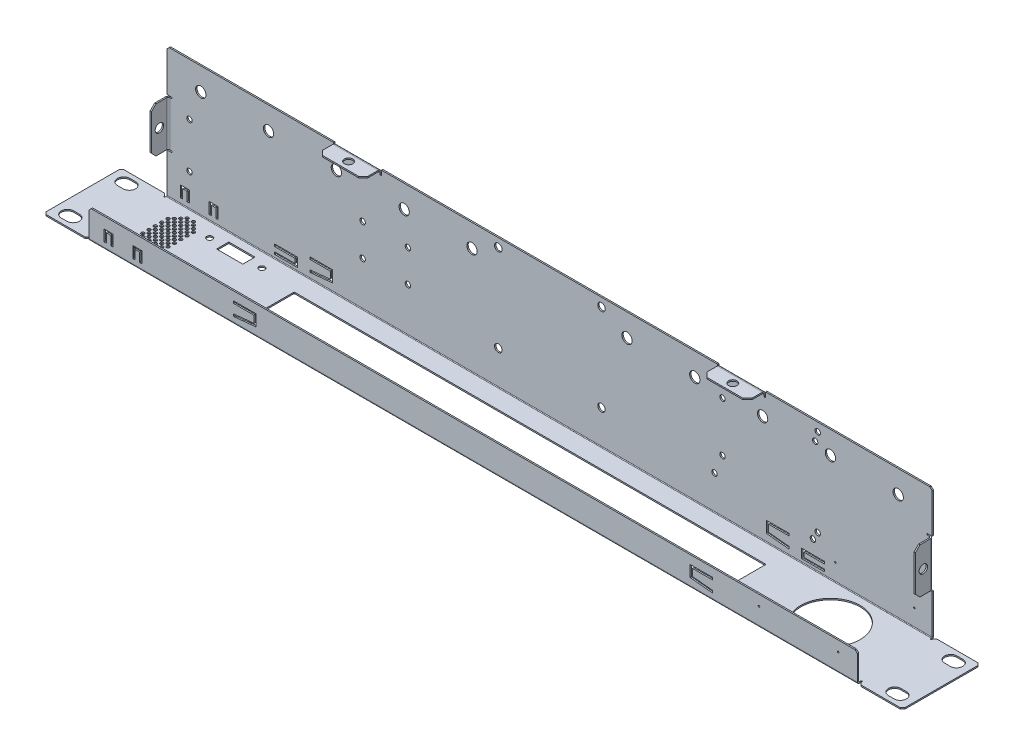
from build123d import *

# Parameters (mm, degrees)
SKETCH2_W                     = 482.6
SKETCH2_H                     = 43.6626
BASE_FLANGE1_DEPTH            = 0.762
EDGE_FLANGE1_STRIP_W          = 3.81
EDGE_FLANGE1_STRIP_H          = 0.762
EDGE_FLANGE1_STRIP_CUT_DEPTH  = 430.022
EDGE_FLANGE1_RELIEF_W         = 4.572
EDGE_FLANGE1_RELIEF_H         = 0.762
EDGE_FLANGE1_RELIEF_CUT_DEPTH = 0.762
EDGE_FLANGE1_DEPTH            = 430.022
EDGE_FLANGE2_START            = -2
EDGE_FLANGE2_DEPTH            = 2.381
EDGE_FLANGE2_START_2          = 0.381
EDGE_FLANGE2_2_OUTLINE_W      = 431.8
EDGE_FLANGE2_2_OUTLINE_H      = 0.762
EDGE_FLANGE2_2_DEPTH          = 15.113
EDGE_FLANGE2_START_3          = -215.9
EDGE_FLANGE2_3_DEPTH          = 431.8
EDGE_FLANGE2_4_DEPTH          = 431.8
CUT_EXTRUDE1_DEPTH            = 2.54
CUT_EXTRUDE2_DEPTH            = 2.54
SKETCH16_R                    = 1.6256
SKETCH16_R_2                  = 16.6624
SKETCH16_W                    = 14.732
SKETCH16_H                    = 6.858
CUT_EXTRUDE3_DEPTH            = 15.875
SKETCH22_R                    = 0.889
CUT_EXTRUDE6_DEPTH            = 10.414
SKETCH31_R                    = 0.4445
CUT_EXTRUDE7_DEPTH            = 53.848
CUT_EXTRUDE10_DEPTH           = 2.54
CUT_EXTRUDE11_DEPTH           = 256.695658712
CUT_EXTRUDE11_DEPTH_BACK      = 256.695658712
SKETCH33_R                    = 2.1082
CUT_EXTRUDE12_DEPTH           = 256.824609924
CHAMFER1_SIZE                 = 1.27
CUT_EXTRUDE13_DEPTH           = 256.695658712
CUT_EXTRUDE13_DEPTH_BACK      = 256.695658712
SKETCH39_R                    = 2.8956
CUT_EXTRUDE14_DEPTH           = 2.54
SKETCH41_R                    = 1.524
CUT_EXTRUDE15_DEPTH           = 2.54
SKETCH42_R                    = 1.524
CUT_EXTRUDE16_DEPTH           = 2.54
SKETCH45_R                    = 1.524
CUT_EXTRUDE17_DEPTH           = 2.54
SKETCH46_R                    = 1.524
CUT_EXTRUDE18_DEPTH           = 2.54
EDGE_FLANGE3_START            = -23
EDGE_FLANGE3_DEPTH            = 2.9213
EDGE_FLANGE3_2_OUTLINE_W      = 0.762
EDGE_FLANGE3_2_OUTLINE_H      = 25.4
EDGE_FLANGE3_2_DEPTH          = 1.24698788
EDGE_FLANGE3_START_2          = -20.0787
EDGE_FLANGE3_3_OUTLINE_W      = 0.762
EDGE_FLANGE3_3_OUTLINE_H      = 25.4
EDGE_FLANGE3_3_DEPTH          = 8.4074
EDGE_FLANGE3_START_3          = 23.3045
EDGE_FLANGE3_4_DEPTH          = 25.4
EDGE_FLANGE3_5_DEPTH          = 25.4
EDGE_FLANGE4_START            = -20.0787
EDGE_FLANGE4_OUTLINE_W        = 25.4
EDGE_FLANGE4_OUTLINE_H        = 0.762
EDGE_FLANGE4_DEPTH            = 8.4074
EDGE_FLANGE4_START_2          = -23
EDGE_FLANGE4_2_DEPTH          = 2.9213
EDGE_FLANGE4_START_3          = 95.25
EDGE_FLANGE4_3_DEPTH          = 25.4
EDGE_FLANGE4_4_DEPTH          = 25.4
EDGE_FLANGE5_START            = -121.412
EDGE_FLANGE5_DEPTH            = 26.924
EDGE_FLANGE5_START_2          = -120.65
EDGE_FLANGE5_2_DEPTH          = 25.4
EDGE_FLANGE5_START_3          = -23
EDGE_FLANGE5_3_DEPTH          = 2.9213
SKETCH60_R                    = 2.3749
CUT_EXTRUDE19_DEPTH           = 2.54
SKETCH61_R                    = 2.3749
CUT_EXTRUDE20_DEPTH           = 463.612637943
CHAMFER2_SIZE                 = 2.54


with BuildPart() as part:
    # Base-Flange1: sheet metal written as solids
    # Sketch2 → Base-Flange1 (new body)
    with BuildSketch(Plane(origin=(0, 0, 0), x_dir=(1, 0, 0), z_dir=(0, 1, 0))):
        Rectangle(SKETCH2_W, SKETCH2_H)
    extrude(amount=-BASE_FLANGE1_DEPTH)

    # Edge-Flange1: sheet metal written as solids
    # Edge-Flange1 strip (on a plane across the edge) → Edge-Flange1 strip cut (cut)
    with BuildSketch(Plane(origin=(215.011, 0, -21.8313), x_dir=(0, 0, 1), z_dir=(-1, 0, 0))):
        with Locations((-0.762, -0.381)):
            Rectangle(EDGE_FLANGE1_STRIP_W, EDGE_FLANGE1_STRIP_H)
    extrude(amount=EDGE_FLANGE1_STRIP_CUT_DEPTH, mode=Mode.SUBTRACT)

    # Edge-Flange1 relief (on the sheet) → Edge-Flange1 relief cut (cut)
    with BuildSketch(Plane(origin=(215.011, 0, -20.6883), x_dir=(0, 0, 1), z_dir=(0, 1, 0))):
        with Locations((-1.524, 0.381)):
            Rectangle(EDGE_FLANGE1_RELIEF_W, EDGE_FLANGE1_RELIEF_H)
        with Locations((-1.524, -430.403)):
            Rectangle(EDGE_FLANGE1_RELIEF_W, EDGE_FLANGE1_RELIEF_H)
    extrude(amount=-EDGE_FLANGE1_RELIEF_CUT_DEPTH, mode=Mode.SUBTRACT)

    # Edge-Flange1 section (on a plane across the edge) → Edge-Flange1 (add)
    with BuildSketch(Plane(origin=(215.011, 0, -21.8313), x_dir=(0, 0, 1), z_dir=(-1, 0, 0))):
        with BuildLine():
            Line((0, 0.381), (0, 72.898))
            Line((0, 72.898), (0.762, 72.898))
            Line((0.762, 72.898), (0.762, 0.381))
            ThreePointArc((0.762, 0.381), (0.873592316, 0.111592316), (1.143, 0))
            Line((1.143, 0), (1.143, -0.762))
            ThreePointArc((1.143, -0.762), (0.334776949, -0.427223051), (0, 0.381))
        make_face()
    extrude(amount=EDGE_FLANGE1_DEPTH)

    # Edge-Flange2: read off the stored shape, not the designer's step
    # Edge-Flange2 outline → Edge-Flange2 (cut)
    with BuildSketch(Plane(origin=(0, 0, 0), x_dir=(1, 0, 0), z_dir=(0, 1, 0)).offset(EDGE_FLANGE2_START)):
        with BuildLine():
            Line((215.9, -19.9263), (215.9, -21.8313))
            Line((215.9, -21.8313), (216.662, -21.8313))
            Line((216.662, -21.8313), (216.662, -19.9263))
            ThreePointArc((216.662, -19.9263), (216.281, -19.5453), (215.9, -19.9263))
        make_face()
        with BuildLine():
            Line((-216.662, -21.8313), (-215.9, -21.8313))
            Line((-215.9, -21.8313), (-215.9, -19.9263))
            ThreePointArc((-215.9, -19.9263), (-216.281, -19.5453), (-216.662, -19.9263))
            Line((-216.662, -19.9263), (-216.662, -21.8313))
        make_face()
    extrude(amount=EDGE_FLANGE2_DEPTH, mode=Mode.SUBTRACT)

    # Edge-Flange2 3 outline → Edge-Flange2 3 (cut)
    with BuildSketch(Plane.YZ.offset(EDGE_FLANGE2_START_3)):
        with BuildLine():
            ThreePointArc((-0.762, 20.6883), (-0.552255592, 21.348211358), (0, 21.765930735))
            Line((0, 21.765930735), (0, 21.8313))
            Line((0, 21.8313), (-0.762, 21.8313))
            Line((-0.762, 21.8313), (-0.762, 20.6883))
        make_face()
    extrude(amount=EDGE_FLANGE2_3_DEPTH, mode=Mode.SUBTRACT)



with BuildPart() as body_2:
    # Edge-Flange2 2 outline → Edge-Flange2 2 (new body)
    with BuildSketch(Plane(origin=(0, 0, 0), x_dir=(1, 0, 0), z_dir=(0, 1, 0)).offset(EDGE_FLANGE2_START_2)):
        with Locations((0, -21.4503)):
            Rectangle(EDGE_FLANGE2_2_OUTLINE_W, EDGE_FLANGE2_2_OUTLINE_H)
    extrude(amount=EDGE_FLANGE2_2_DEPTH)


with BuildPart() as part_1:
    add(part.part)

    add(body_2.part)  # Edge-Flange2 4 merges body 2
    # Edge-Flange2 4 outline → Edge-Flange2 4 (add)
    with BuildSketch(Plane.YZ.offset(EDGE_FLANGE2_START_3)):
        with BuildLine():
            Line((0.381, 21.0693), (0.381, 21.8313))
            ThreePointArc((0.381, 21.8313), (0.187716438, 21.814839154), (0, 21.765930735))
            Line((0, 21.765930735), (0, 20.6883))
            ThreePointArc((0, 20.6883), (0.111592316, 20.957707684), (0.381, 21.0693))
        make_face()
    extrude(amount=EDGE_FLANGE2_4_DEPTH)

    # Sketch14 → Cut-Extrude1 (cut)
    with BuildSketch(Plane.XZ.offset(0.762)):
        with BuildLine():
            Line((230.8225, -19.2913), (233.9975, -19.2913))
            ThreePointArc((233.9975, -19.2913), (237.49, -15.7988), (233.9975, -12.3063))
            Line((233.9975, -12.3063), (230.8225, -12.3063))
            ThreePointArc((230.8225, -12.3063), (227.33, -15.7988), (230.8225, -19.2913))
        make_face()
        with BuildLine():
            Line((230.8225, 12.3063), (233.9975, 12.3063))
            ThreePointArc((233.9975, 12.3063), (237.49, 15.7988), (233.9975, 19.2913))
            Line((233.9975, 19.2913), (230.8225, 19.2913))
            ThreePointArc((230.8225, 19.2913), (227.33, 15.7988), (230.8225, 12.3063))
        make_face()
        with BuildLine():
            Line((-230.8225, 19.2913), (-233.9975, 19.2913))
            ThreePointArc((-233.9975, 19.2913), (-237.49, 15.7988), (-233.9975, 12.3063))
            Line((-233.9975, 12.3063), (-230.8225, 12.3063))
            ThreePointArc((-230.8225, 12.3063), (-227.33, 15.7988), (-230.8225, 19.2913))
        make_face()
        with BuildLine():
            Line((-230.8225, -12.3063), (-233.9975, -12.3063))
            ThreePointArc((-233.9975, -12.3063), (-237.49, -15.7988), (-233.9975, -19.2913))
            Line((-233.9975, -19.2913), (-230.8225, -19.2913))
            ThreePointArc((-230.8225, -19.2913), (-227.33, -15.7988), (-230.8225, -12.3063))
        make_face()
    extrude(amount=-CUT_EXTRUDE1_DEPTH, mode=Mode.SUBTRACT)

    # Sketch15 → Cut-Extrude2 (cut)
    with BuildSketch(Plane.XZ.offset(0.762)):
        with BuildLine():
            Line((-132.11175, 16.764), (132.11175, 16.764))
            ThreePointArc((132.11175, 16.764), (132.426058964, 16.633808964), (132.55625, 16.3195))
            Line((132.55625, 16.3195), (132.55625, -9.7155))
            ThreePointArc((132.55625, -9.7155), (132.426058964, -10.029808964), (132.11175, -10.16))
            Line((132.11175, -10.16), (-132.11175, -10.16))
            ThreePointArc((-132.11175, -10.16), (-132.426058964, -10.029808964), (-132.55625, -9.7155))
            Line((-132.55625, -9.7155), (-132.55625, 16.3195))
            ThreePointArc((-132.55625, 16.3195), (-132.426058964, 16.633808964), (-132.11175, 16.764))
        make_face()
    extrude(amount=-CUT_EXTRUDE2_DEPTH, mode=Mode.SUBTRACT)

    # Sketch16 → Cut-Extrude3 (cut)
    with BuildSketch(Plane.XZ.offset(0.762)):
        with Locations(Location((-182.578968496, -12.7, 0), (0, 0, 270))):
            Circle(SKETCH16_R)
        with Locations(Location((-153.235989929, -12.7, 0), (0, 0, 270))):
            Circle(SKETCH16_R)
        with Locations(Location((178.959736329, 0, 0), (0, 0, 270))):
            Circle(SKETCH16_R_2)
        with Locations((-167.907479213, -12.7)):
            Rectangle(SKETCH16_W, SKETCH16_H)
    extrude(amount=-CUT_EXTRUDE3_DEPTH, mode=Mode.SUBTRACT)

    # Sketch22 → Cut-Extrude6 (cut)
    with BuildSketch(Plane(origin=(0, 0, 0), x_dir=(1, 0, 0), z_dir=(0, 1, 0))):
        with Locations(Location((-195.108436701, -1.706248663, 0), (0, 0, 270))):
            Circle(SKETCH22_R)
        with Locations(Location((-196.814685364, 0, 0), (0, 0, 270))):
            Circle(SKETCH22_R)
        with Locations(Location((-193.402188038, -3.412497326, 0), (0, 0, 270))):
            Circle(SKETCH22_R)
        with Locations(Location((-189.989690712, -6.824994652, 0), (0, 0, 270))):
            Circle(SKETCH22_R)
        with Locations(Location((-189.989690712, -10.380994652, 0), (0, 0, 270))):
            Circle(SKETCH22_R)
        with Locations(Location((-191.695939375, -12.230745989, 0), (0, 0, 270))):
            Circle(SKETCH22_R)
        with Locations(Location((-193.402188038, -14.080497326, 0), (0, 0, 270))):
            Circle(SKETCH22_R)
        with Locations(Location((-195.108436701, -15.930248663, 0), (0, 0, 270))):
            Circle(SKETCH22_R)
        with Locations(Location((-198.520934027, -16.073751337, 0), (0, 0, 270))):
            Circle(SKETCH22_R)
        with Locations(Location((-200.22718269, -14.367502674, 0), (0, 0, 270))):
            Circle(SKETCH22_R)
        with Locations(Location((-203.639680016, -10.955005348, 0), (0, 0, 270))):
            Circle(SKETCH22_R)
        with Locations(Location((-203.639680016, -7.399005348, 0), (0, 0, 270))):
            Circle(SKETCH22_R)
        with Locations(Location((-203.639680016, -3.843005348, 0), (0, 0, 270))):
            Circle(SKETCH22_R)
        with Locations(Location((-203.639680016, -0.287005348, 0), (0, 0, 270))):
            Circle(SKETCH22_R)
        with Locations(Location((-203.639680016, 3.268994652, 0), (0, 0, 270))):
            Circle(SKETCH22_R)
        with Locations(Location((-203.639680016, 10.380994652, 0), (0, 0, 270))):
            Circle(SKETCH22_R)
        with Locations(Location((-201.933431353, 12.230745989, 0), (0, 0, 270))):
            Circle(SKETCH22_R)
        with Locations(Location((-200.22718269, 14.080497326, 0), (0, 0, 270))):
            Circle(SKETCH22_R)
        with Locations(Location((-198.520934027, 15.930248663, 0), (0, 0, 270))):
            Circle(SKETCH22_R)
        with Locations(Location((-195.108436701, 16.073751337, 0), (0, 0, 270))):
            Circle(SKETCH22_R)
        with Locations(Location((-193.402188038, 14.367502674, 0), (0, 0, 270))):
            Circle(SKETCH22_R)
        with Locations(Location((-191.695939375, 12.661254011, 0), (0, 0, 270))):
            Circle(SKETCH22_R)
        with Locations(Location((-189.989690712, 10.955005348, 0), (0, 0, 270))):
            Circle(SKETCH22_R)
        with Locations(Location((-189.989690712, 7.399005348, 0), (0, 0, 270))):
            Circle(SKETCH22_R)
        with Locations(Location((-189.989690712, 3.843005348, 0), (0, 0, 270))):
            Circle(SKETCH22_R)
        with Locations(Location((-189.989690712, 0.287005348, 0), (0, 0, 270))):
            Circle(SKETCH22_R)
        with Locations(Location((-189.989690712, -3.268994652, 0), (0, 0, 270))):
            Circle(SKETCH22_R)
        with Locations(Location((-191.695939375, -5.118745989, 0), (0, 0, 270))):
            Circle(SKETCH22_R)
        with Locations(Location((-196.814685364, -14.224, 0), (0, 0, 270))):
            Circle(SKETCH22_R)
        with Locations(Location((-198.520934027, -12.517751337, 0), (0, 0, 270))):
            Circle(SKETCH22_R)
        with Locations(Location((-195.108436701, -12.374248663, 0), (0, 0, 270))):
            Circle(SKETCH22_R)
        with Locations(Location((-196.814685364, -10.668, 0), (0, 0, 270))):
            Circle(SKETCH22_R)
        with Locations(Location((-200.22718269, -10.811502674, 0), (0, 0, 270))):
            Circle(SKETCH22_R)
        with Locations(Location((-193.402188038, -10.524497326, 0), (0, 0, 270))):
            Circle(SKETCH22_R)
        with Locations(Location((-201.933431353, -9.105254011, 0), (0, 0, 270))):
            Circle(SKETCH22_R)
        with Locations(Location((-198.520934027, -8.961751337, 0), (0, 0, 270))):
            Circle(SKETCH22_R)
        with Locations(Location((-195.108436701, -8.818248663, 0), (0, 0, 270))):
            Circle(SKETCH22_R)
        with Locations(Location((-191.695939375, -8.674745989, 0), (0, 0, 270))):
            Circle(SKETCH22_R)
        with Locations(Location((-200.22718269, -7.255502674, 0), (0, 0, 270))):
            Circle(SKETCH22_R)
        with Locations(Location((-196.814685364, -7.112, 0), (0, 0, 270))):
            Circle(SKETCH22_R)
        with Locations(Location((-193.402188038, -6.968497326, 0), (0, 0, 270))):
            Circle(SKETCH22_R)
        with Locations(Location((-201.933431353, -5.549254011, 0), (0, 0, 270))):
            Circle(SKETCH22_R)
        with Locations(Location((-198.520934027, -5.405751337, 0), (0, 0, 270))):
            Circle(SKETCH22_R)
        with Locations(Location((-195.108436701, -5.262248663, 0), (0, 0, 270))):
            Circle(SKETCH22_R)
        with Locations(Location((-200.22718269, -3.699502674, 0), (0, 0, 270))):
            Circle(SKETCH22_R)
        with Locations(Location((-196.814685364, -3.556, 0), (0, 0, 270))):
            Circle(SKETCH22_R)
        with Locations(Location((-191.695939375, -1.562745989, 0), (0, 0, 270))):
            Circle(SKETCH22_R)
        with Locations(Location((-198.520934027, -1.849751337, 0), (0, 0, 270))):
            Circle(SKETCH22_R)
        with Locations(Location((-201.933431353, -1.993254011, 0), (0, 0, 270))):
            Circle(SKETCH22_R)
        with Locations(Location((-200.22718269, -0.143502674, 0), (0, 0, 270))):
            Circle(SKETCH22_R)
        with Locations(Location((-201.933431353, 1.562745989, 0), (0, 0, 270))):
            Circle(SKETCH22_R)
        with Locations(Location((-195.108436701, 1.849751337, 0), (0, 0, 270))):
            Circle(SKETCH22_R)
        with Locations(Location((-193.402188038, 0.143502674, 0), (0, 0, 270))):
            Circle(SKETCH22_R)
        with Locations(Location((-191.695939375, 1.993254011, 0), (0, 0, 270))):
            Circle(SKETCH22_R)
        with Locations(Location((-198.520934027, 1.706248663, 0), (0, 0, 270))):
            Circle(SKETCH22_R)
        with Locations(Location((-200.22718269, 3.412497326, 0), (0, 0, 270))):
            Circle(SKETCH22_R)
        with Locations(Location((-196.814685364, 3.556, 0), (0, 0, 270))):
            Circle(SKETCH22_R)
        with Locations(Location((-193.402188038, 3.699502674, 0), (0, 0, 270))):
            Circle(SKETCH22_R)
        with Locations(Location((-191.695939375, 5.549254011, 0), (0, 0, 270))):
            Circle(SKETCH22_R)
        with Locations(Location((-195.108436701, 5.405751337, 0), (0, 0, 270))):
            Circle(SKETCH22_R)
        with Locations(Location((-198.520934027, 5.262248663, 0), (0, 0, 270))):
            Circle(SKETCH22_R)
        with Locations(Location((-200.22718269, 6.968497326, 0), (0, 0, 270))):
            Circle(SKETCH22_R)
        with Locations(Location((-201.933431353, 5.118745989, 0), (0, 0, 270))):
            Circle(SKETCH22_R)
        with Locations(Location((-196.814685364, 7.112, 0), (0, 0, 270))):
            Circle(SKETCH22_R)
        with Locations(Location((-193.402188038, 7.255502674, 0), (0, 0, 270))):
            Circle(SKETCH22_R)
        with Locations(Location((-195.108436701, 8.961751337, 0), (0, 0, 270))):
            Circle(SKETCH22_R)
        with Locations(Location((-191.695939375, 9.105254011, 0), (0, 0, 270))):
            Circle(SKETCH22_R)
        with Locations(Location((-198.520934027, 8.818248663, 0), (0, 0, 270))):
            Circle(SKETCH22_R)
        with Locations(Location((-201.933431353, 8.674745989, 0), (0, 0, 270))):
            Circle(SKETCH22_R)
        with Locations(Location((-196.814685364, 10.668, 0), (0, 0, 270))):
            Circle(SKETCH22_R)
        with Locations(Location((-193.402188038, 10.811502674, 0), (0, 0, 270))):
            Circle(SKETCH22_R)
        with Locations(Location((-196.814685364, 14.224, 0), (0, 0, 270))):
            Circle(SKETCH22_R)
        with Locations(Location((-195.108436701, 12.517751337, 0), (0, 0, 270))):
            Circle(SKETCH22_R)
        with Locations(Location((-198.520934027, 12.374248663, 0), (0, 0, 270))):
            Circle(SKETCH22_R)
        with Locations(Location((-200.22718269, 10.524497326, 0), (0, 0, 270))):
            Circle(SKETCH22_R)
        with Locations(Location((-203.639680016, 6.824994652, 0), (0, 0, 270))):
            Circle(SKETCH22_R)
        with Locations(Location((-201.933431353, -12.661254011, 0), (0, 0, 270))):
            Circle(SKETCH22_R)
    extrude(amount=-CUT_EXTRUDE6_DEPTH, mode=Mode.SUBTRACT)

    # Sketch31 → Cut-Extrude7 (cut)
    with BuildSketch(Plane.XY.offset(21.8313)):
        with Locations((205.060246339, 9.5885)):
            Circle(SKETCH31_R)
        with Locations((160.610246339, 9.5885)):
            Circle(SKETCH31_R)
    extrude(amount=-CUT_EXTRUDE7_DEPTH, mode=Mode.SUBTRACT)

    # Sketch34 → Cut-Extrude10 (cut)
    with BuildSketch(Plane.XY.offset(-21.0693)):
        Polygon((-154.4066, 6.985), (-154.4066, 5.715), (-142.9766, 5.715), (-142.9766, 3.175), (-154.4066, 3.175), (-154.4066, 1.905), (-141.7066, 1.905), (-141.7066, 6.985), align=None)
        Polygon((141.7066, 6.985), (141.7066, 1.905), (154.4066, 1.905), (154.4066, 3.175), (142.9766, 3.175), (142.9766, 5.715), (154.4066, 5.715), (154.4066, 6.985), align=None)
    extrude(amount=-CUT_EXTRUDE10_DEPTH, mode=Mode.SUBTRACT)

    # Sketch35 → Cut-Extrude11 (cut, two sides: drawn at the far end of the back side and taken through both)
    with BuildSketch(Plane(origin=(0, 0, 21.0693), x_dir=(-1, 0, 0), z_dir=(0, 0, -1)).offset(-CUT_EXTRUDE11_DEPTH_BACK)):
        Polygon((123.19, 5.424457691), (134.62, 4.32387387), (134.498275894, 3.059720698), (121.92, 4.270870912), (121.92, 10.668), (134.62, 10.668), (134.62, 9.398), (123.19, 9.398), align=None)
        Polygon((-134.498275894, 3.059720698), (-134.62, 4.32387387), (-123.19, 5.424457691), (-123.19, 9.398), (-134.62, 9.398), (-134.62, 10.668), (-121.92, 10.668), (-121.92, 4.270870912), align=None)
    extrude(amount=CUT_EXTRUDE11_DEPTH + CUT_EXTRUDE11_DEPTH_BACK, mode=Mode.SUBTRACT)

    # Sketch33 → Cut-Extrude12 (cut, through all)
    with BuildSketch(Plane(origin=(0, 0, -21.8313), x_dir=(-1, 0, 0), z_dir=(0, 0, -1))):
        with Locations(Location((-29.228077599, 68.125166205, 0), (0, 0, 90))):
            Circle(SKETCH33_R)
        with Locations(Location((28.771907581, 68.132146338, 0), (0, 0, 90))):
            Circle(SKETCH33_R)
        with Locations(Location((-29.222180588, 19.12516656, 0), (0, 0, 90))):
            Circle(SKETCH33_R)
        with Locations(Location((28.777804592, 19.132143093, 0), (0, 0, 90))):
            Circle(SKETCH33_R)
    extrude(amount=-CUT_EXTRUDE12_DEPTH, mode=Mode.SUBTRACT)

    # Chamfer1
    chamfer1_edges = [part_1.edges().sort_by_distance(p)[0] for p in [
        (215.773, -0.381, -21.8313),
        (-215.773, -0.381, -21.8313),
        (215.011, 72.898, -21.4503),
        (-215.011, 72.898, -21.4503),
        (-216.662, -0.381, 21.8313),
        (216.662, -0.381, 21.8313),
        (241.3, -0.381, 21.8313),
        (-241.3, -0.381, 21.8313),
        (-241.3, -0.381, -21.8313),
        (241.3, -0.381, -21.8313),
        (-215.9, 15.494, 21.4503),
        (215.9, 15.494, 21.4503),
    ]]
    chamfer(chamfer1_edges, length=CHAMFER1_SIZE)

    # Sketch37 → Cut-Extrude13 (cut, two sides: drawn at the far end of the back side and taken through both)
    with BuildSketch(Plane.XY.offset(-21.0693).offset(-CUT_EXTRUDE13_DEPTH_BACK)):
        Polygon((-187.45607289, 2.921), (-187.45607289, 8.001), (-189.99607289, 8.001), (-189.99607289, 2.921), (-191.26607289, 2.921), (-191.26607289, 9.271), (-186.18607289, 9.271), (-186.18607289, 2.921), align=None)
        Polygon((-202.363297886, 2.921), (-203.633297886, 2.921), (-203.633297886, 8.001), (-206.173297886, 8.001), (-206.173297886, 2.921), (-207.443297886, 2.921), (-207.443297886, 9.271), (-202.363297886, 9.271), align=None)
    extrude(amount=CUT_EXTRUDE13_DEPTH + CUT_EXTRUDE13_DEPTH_BACK, mode=Mode.SUBTRACT)

    # Sketch39 → Cut-Extrude14 (cut)
    with BuildSketch(Plane.XY.offset(-21.0693)):
        with Locations((195.961, 60.198)):
            Circle(SKETCH39_R)
        with Locations((157.861, 60.198)):
            Circle(SKETCH39_R)
        with Locations((119.761, 60.198)):
            Circle(SKETCH39_R)
        with Locations((81.661, 60.198)):
            Circle(SKETCH39_R)
        with Locations((43.561, 60.198)):
            Circle(SKETCH39_R)
        with Locations(Location((-43.561, 60.198, 0), (0, 0, 270))):
            Circle(SKETCH39_R)
        with Locations(Location((-81.661, 60.198, 0), (0, 0, 270))):
            Circle(SKETCH39_R)
        with Locations(Location((-119.761, 60.198, 0), (0, 0, 270))):
            Circle(SKETCH39_R)
        with Locations(Location((-157.861, 60.198, 0), (0, 0, 270))):
            Circle(SKETCH39_R)
        with Locations(Location((-195.961, 60.198, 0), (0, 0, 270))):
            Circle(SKETCH39_R)
    extrude(amount=-CUT_EXTRUDE14_DEPTH, mode=Mode.SUBTRACT)

    # Sketch41 → Cut-Extrude15 (cut)
    with BuildSketch(Plane.XY.offset(-21.0693)):
        with Locations((97.224554797, 57.75379371)):
            Circle(SKETCH41_R)
        with Locations((97.224554797, 29.81379371)):
            Circle(SKETCH41_R)
        with Locations((148.024554797, 14.57379371)):
            Circle(SKETCH41_R)
        with Locations((149.294554797, 62.83379371)):
            Circle(SKETCH41_R)
    extrude(amount=-CUT_EXTRUDE15_DEPTH, mode=Mode.SUBTRACT)

    # Sketch42 → Cut-Extrude16 (cut)
    with BuildSketch(Plane.XY.offset(-21.0693)):
        with Locations((-79.566423338, 42.64893561)):
            Circle(SKETCH42_R)
        with Locations((-104.966423338, 42.64893561)):
            Circle(SKETCH42_R)
        with Locations((-79.566423338, 24.635933192)):
            Circle(SKETCH42_R)
        with Locations((-104.966423338, 24.635933192)):
            Circle(SKETCH42_R)
    extrude(amount=-CUT_EXTRUDE16_DEPTH, mode=Mode.SUBTRACT)

    # Sketch45 → Cut-Extrude17 (cut)
    with BuildSketch(Plane.XY.offset(-21.0693)):
        with Locations((92.722180588, 19.125215382)):
            Circle(SKETCH45_R)
        with Locations((92.728078053, 68.125117027)):
            Circle(SKETCH45_R)
        with Locations((150.727962053, 68.125117382)):
            Circle(SKETCH45_R)
        with Locations((150.722064588, 19.125215382)):
            Circle(SKETCH45_R)
    extrude(amount=-CUT_EXTRUDE17_DEPTH, mode=Mode.SUBTRACT)

    # Sketch46 → Cut-Extrude18 (cut)
    with BuildSketch(Plane.XY.offset(-21.0693)):
        with Locations((-202.311, 18.288)):
            Circle(SKETCH46_R)
        with Locations((-202.311, 43.688)):
            Circle(SKETCH46_R)
    extrude(amount=-CUT_EXTRUDE18_DEPTH, mode=Mode.SUBTRACT)

    # Edge-Flange3: read off the stored shape, not the designer's step
    # Edge-Flange3 outline → Edge-Flange3 (cut)
    with BuildSketch(Plane.XY.offset(EDGE_FLANGE3_START)):
        with BuildLine():
            Line((212.4964, 48.7045), (215.011, 48.7045))
            Line((215.011, 48.7045), (215.011, 49.4665))
            Line((215.011, 49.4665), (212.4964, 49.4665))
            ThreePointArc((212.4964, 49.4665), (212.1154, 49.0855), (212.4964, 48.7045))
        make_face()
        with BuildLine():
            Line((215.011, 22.5425), (215.011, 23.3045))
            Line((215.011, 23.3045), (212.4964, 23.3045))
            ThreePointArc((212.4964, 23.3045), (212.1154, 22.9235), (212.4964, 22.5425))
            Line((212.4964, 22.5425), (215.011, 22.5425))
        make_face()
        with BuildLine():
            Line((-212.4964, 23.3045), (-215.011, 23.3045))
            Line((-215.011, 23.3045), (-215.011, 22.5425))
            Line((-215.011, 22.5425), (-212.4964, 22.5425))
            ThreePointArc((-212.4964, 22.5425), (-212.1154, 22.9235), (-212.4964, 23.3045))
        make_face()
        with BuildLine():
            Line((-215.011, 49.4665), (-215.011, 48.7045))
            Line((-215.011, 48.7045), (-212.4964, 48.7045))
            ThreePointArc((-212.4964, 48.7045), (-212.1154, 49.0855), (-212.4964, 49.4665))
            Line((-212.4964, 49.4665), (-215.011, 49.4665))
        make_face()
    extrude(amount=EDGE_FLANGE3_DEPTH, mode=Mode.SUBTRACT)

    # Edge-Flange3 2 outline → Edge-Flange3 2 (cut)
    with BuildSketch(Plane.XY.offset(EDGE_FLANGE3_START)):
        with Locations((214.63, 36.0045)):
            Rectangle(EDGE_FLANGE3_2_OUTLINE_W, EDGE_FLANGE3_2_OUTLINE_H)
        with Locations((-214.63, 36.0045)):
            Rectangle(EDGE_FLANGE3_2_OUTLINE_W, EDGE_FLANGE3_2_OUTLINE_H)
    extrude(amount=EDGE_FLANGE3_2_DEPTH, mode=Mode.SUBTRACT)

    # Edge-Flange3 4 outline → Edge-Flange3 4 (cut)
    with BuildSketch(Plane(origin=(0, 0, 0), x_dir=(1, 0, 0), z_dir=(0, 1, 0)).offset(EDGE_FLANGE3_START_3)):
        with BuildLine():
            Line((-215.011, 21.0693), (-214.704193347, 21.0693))
            ThreePointArc((-214.704193347, 21.0693), (-214.075553964, 21.629140634), (-213.2584, 21.8313))
            Line((-213.2584, 21.8313), (-214.249, 21.8313))
            Line((-214.249, 21.8313), (-214.249, 21.75301212))
            Line((-214.249, 21.75301212), (-215.011, 21.75301212))
            Line((-215.011, 21.75301212), (-215.011, 21.0693))
        make_face()
        with BuildLine():
            Line((214.249, 21.8313), (213.2584, 21.8313))
            ThreePointArc((213.2584, 21.8313), (214.075553964, 21.629140634), (214.704193347, 21.0693))
            Line((214.704193347, 21.0693), (215.011, 21.0693))
            Line((215.011, 21.0693), (215.011, 21.75301212))
            Line((215.011, 21.75301212), (214.249, 21.75301212))
            Line((214.249, 21.75301212), (214.249, 21.8313))
        make_face()
    extrude(amount=EDGE_FLANGE3_4_DEPTH, mode=Mode.SUBTRACT)



with BuildPart() as body_2_2:
    # Edge-Flange3 3 outline → Edge-Flange3 3 (new body)
    with BuildSketch(Plane.XY.offset(EDGE_FLANGE3_START_2)):
        with Locations((214.63, 36.0045)):
            Rectangle(EDGE_FLANGE3_3_OUTLINE_W, EDGE_FLANGE3_3_OUTLINE_H)
        with Locations((-214.63, 36.0045)):
            Rectangle(EDGE_FLANGE3_3_OUTLINE_W, EDGE_FLANGE3_3_OUTLINE_H)
    extrude(amount=EDGE_FLANGE3_3_DEPTH)


with BuildPart() as part_2:
    add(part_1.part)

    add(body_2_2.part)  # Edge-Flange3 5 merges body 2 2
    # Edge-Flange3 5 outline → Edge-Flange3 5 (add)
    with BuildSketch(Plane(origin=(0, 0, 0), x_dir=(1, 0, 0), z_dir=(0, 1, 0)).offset(EDGE_FLANGE3_START_3)):
        with BuildLine():
            ThreePointArc((-214.704193347, 21.0693), (-214.932542195, 20.597211977), (-215.011, 20.0787))
            Line((-215.011, 20.0787), (-214.249, 20.0787))
            ThreePointArc((-214.249, 20.0787), (-213.958859977, 20.779159977), (-213.2584, 21.0693))
            Line((-213.2584, 21.0693), (-214.704193347, 21.0693))
        make_face()
        with BuildLine():
            Line((214.704193347, 21.0693), (213.2584, 21.0693))
            ThreePointArc((213.2584, 21.0693), (213.958859977, 20.779159977), (214.249, 20.0787))
            Line((214.249, 20.0787), (215.011, 20.0787))
            ThreePointArc((215.011, 20.0787), (214.932542195, 20.597211977), (214.704193347, 21.0693))
        make_face()
    extrude(amount=EDGE_FLANGE3_5_DEPTH)

    # Edge-Flange4 2 outline → Edge-Flange4 2 (cut)
    with BuildSketch(Plane.XY.offset(EDGE_FLANGE4_START_2)):
        with BuildLine():
            Line((121.412, 72.898), (120.65, 72.898))
            Line((120.65, 72.898), (120.65, 70.3834))
            ThreePointArc((120.65, 70.3834), (121.031, 70.0024), (121.412, 70.3834))
            Line((121.412, 70.3834), (121.412, 72.898))
        make_face()
        with BuildLine():
            ThreePointArc((94.488, 70.3834), (94.869, 70.0024), (95.25, 70.3834))
            Line((95.25, 70.3834), (95.25, 72.898))
            Line((95.25, 72.898), (94.488, 72.898))
            Line((94.488, 72.898), (94.488, 70.3834))
        make_face()
    extrude(amount=EDGE_FLANGE4_2_DEPTH, mode=Mode.SUBTRACT)

    # Edge-Flange4 3 outline → Edge-Flange4 3 (cut)
    with BuildSketch(Plane.YZ.offset(EDGE_FLANGE4_START_3)):
        with BuildLine():
            Line((72.898, -21.0693), (72.591193347, -21.0693))
            ThreePointArc((72.591193347, -21.0693), (71.962553964, -21.629140634), (71.1454, -21.8313))
            Line((71.1454, -21.8313), (72.898, -21.8313))
            Line((72.898, -21.8313), (72.898, -21.0693))
        make_face()
    extrude(amount=EDGE_FLANGE4_3_DEPTH, mode=Mode.SUBTRACT)



with BuildPart() as body_2_3:
    # Edge-Flange4: read off the stored shape, not the designer's step
    # Edge-Flange4 outline → Edge-Flange4 (new body)
    with BuildSketch(Plane.XY.offset(EDGE_FLANGE4_START)):
        with Locations((107.95, 72.517)):
            Rectangle(EDGE_FLANGE4_OUTLINE_W, EDGE_FLANGE4_OUTLINE_H)
    extrude(amount=EDGE_FLANGE4_DEPTH)


with BuildPart() as part_3:
    add(part_2.part)

    add(body_2_3.part)  # Edge-Flange4 4 merges body 2 3
    # Edge-Flange4 4 outline → Edge-Flange4 4 (add)
    with BuildSketch(Plane.YZ.offset(EDGE_FLANGE4_START_3)):
        with BuildLine():
            ThreePointArc((72.591193347, -21.0693), (72.819542195, -20.597211977), (72.898, -20.0787))
            Line((72.898, -20.0787), (72.136, -20.0787))
            ThreePointArc((72.136, -20.0787), (71.845859977, -20.779159977), (71.1454, -21.0693))
            Line((71.1454, -21.0693), (72.591193347, -21.0693))
        make_face()
    extrude(amount=EDGE_FLANGE4_4_DEPTH)

    # Edge-Flange5: read off the stored shape, not the designer's step
    # Edge-Flange5 outline → Edge-Flange5 (cut)
    with BuildSketch(Plane.YZ.offset(EDGE_FLANGE5_START)):
        with BuildLine():
            Line((72.898, -21.0693), (72.591193347, -21.0693))
            ThreePointArc((72.591193347, -21.0693), (71.962553964, -21.629140634), (71.1454, -21.8313))
            Line((71.1454, -21.8313), (72.898, -21.8313))
            Line((72.898, -21.8313), (72.898, -21.0693))
        make_face()
    extrude(amount=EDGE_FLANGE5_DEPTH, mode=Mode.SUBTRACT)

    # Edge-Flange5 2 outline → Edge-Flange5 2 (add)
    with BuildSketch(Plane.YZ.offset(EDGE_FLANGE5_START_2)):
        with BuildLine():
            Line((72.898, -20.0787), (72.898, -11.6713))
            Line((72.898, -11.6713), (72.136, -11.6713))
            Line((72.136, -11.6713), (72.136, -20.0787))
            ThreePointArc((72.136, -20.0787), (71.845859977, -20.779159977), (71.1454, -21.0693))
            Line((71.1454, -21.0693), (72.591193347, -21.0693))
            ThreePointArc((72.591193347, -21.0693), (72.819542195, -20.597211977), (72.898, -20.0787))
        make_face()
    extrude(amount=EDGE_FLANGE5_2_DEPTH)

    # Edge-Flange5 3 outline → Edge-Flange5 3 (cut)
    with BuildSketch(Plane.XY.offset(EDGE_FLANGE5_START_3)):
        with BuildLine():
            ThreePointArc((-121.412, 70.3834), (-121.031, 70.0024), (-120.65, 70.3834))
            Line((-120.65, 70.3834), (-120.65, 74))
            Line((-120.65, 74), (-121.412, 74))
            Line((-121.412, 74), (-121.412, 70.3834))
        make_face()
        with BuildLine():
            Line((-94.488, 74), (-95.25, 74))
            Line((-95.25, 74), (-95.25, 70.3834))
            ThreePointArc((-95.25, 70.3834), (-94.869, 70.0024), (-94.488, 70.3834))
            Line((-94.488, 70.3834), (-94.488, 74))
        make_face()
    extrude(amount=EDGE_FLANGE5_3_DEPTH, mode=Mode.SUBTRACT)

    # Sketch60 → Cut-Extrude19 (cut)
    with BuildSketch(Plane(origin=(0, 72.898, 0), x_dir=(1, 0, 0), z_dir=(0, 1, 0))):
        with Locations(Location((107.95, 16.1163, 0), (0, 0, 270))):
            Circle(SKETCH60_R)
        with Locations(Location((-107.95, 16.1163, 0), (0, 0, 90))):
            Circle(SKETCH60_R)
    extrude(amount=-CUT_EXTRUDE19_DEPTH, mode=Mode.SUBTRACT)

    # Sketch61 → Cut-Extrude20 (cut, through all)
    with BuildSketch(Plane(origin=(215.011, 0, 0), x_dir=(0, 0, -1), z_dir=(1, 0, 0))):
        with Locations((16.1163, 36.0045)):
            Circle(SKETCH61_R)
    extrude(amount=-CUT_EXTRUDE20_DEPTH, mode=Mode.SUBTRACT)

    # Chamfer2
    chamfer2_edges = [part_3.edges().sort_by_distance(p)[0] for p in [
        (-214.63, 48.7045, -11.6713),
        (-214.63, 23.3045, -11.6713),
        (214.63, 23.3045, -11.6713),
        (214.63, 48.7045, -11.6713),
        (120.65, 72.517, -11.6713),
        (95.25, 72.517, -11.6713),
        (-95.25, 72.517, -11.6713),
        (-120.65, 72.517, -11.6713),
    ]]
    chamfer(chamfer2_edges, length=CHAMFER2_SIZE)


solid = part_3.part
